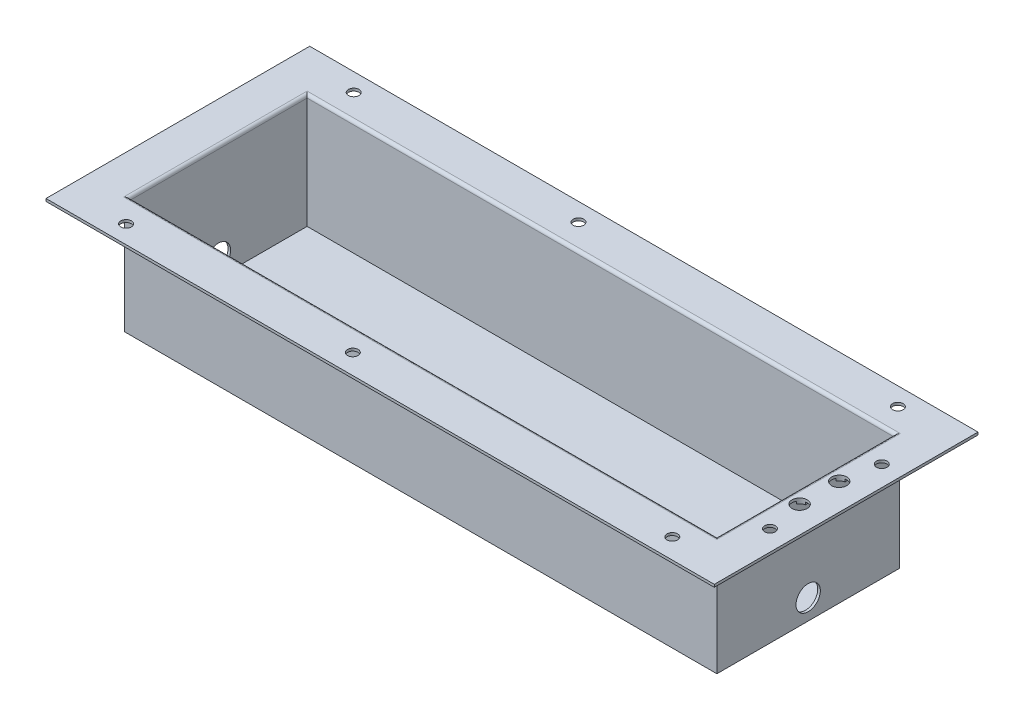
from build123d import *

# Parameters (mm, degrees)
SKETCH1_W                = 370.84
SKETCH1_H                = 114.3
BOSS_EXTRUDE1_DEPTH      = 1.6256
SKETCH2_W                = 367.5888
SKETCH2_H                = 111.0488
BOSS_EXTRUDE2_DEPTH      = 69.85
SKETCH3_W                = 418.3888
SKETCH3_H                = 165.1
SKETCH3_W_2              = 367.5888
SKETCH3_H_2              = 111.0488
BOSS_EXTRUDE3_DEPTH      = 1.6256
FILLET1_R                = 1.905
SKETCH6_W                = 376.4788
SKETCH6_H                = 119.9388
BOSS_EXTRUDE4_DEPTH      = 3.175
SKETCH8_R                = 7.62
CUT_EXTRUDE2_DEPTH       = 410.730170513
CUT_EXTRUDE10_DEPTH      = 237.475336838
CUT_EXTRUDE10_DEPTH_BACK = 237.475336838
SKETCH13_R               = 3.325
CUT_EXTRUDE11_DEPTH      = 237.475336838
CUT_EXTRUDE11_DEPTH_BACK = 237.475336838
SKETCH14_R               = 4.75


with BuildPart() as part:
    # Sketch1 → Boss-Extrude1 (new body)
    with BuildSketch(Plane(origin=(0, 0, 0), x_dir=(1, 0, 0), z_dir=(0, 1, 0))):
        Rectangle(SKETCH1_W, SKETCH1_H)
    extrude(amount=BOSS_EXTRUDE1_DEPTH)

    # Sketch2 → Boss-Extrude2 (add)
    with BuildSketch(Plane(origin=(0, 1.6256, 0), x_dir=(1, 0, 0), z_dir=(0, 1, 0))):
        Polygon((-183.7944, 57.15), (-185.42, 57.15), (-185.42, -57.15), (185.42, -57.15), (185.42, 57.15), align=None)
        Rectangle(SKETCH2_W, SKETCH2_H, mode=Mode.SUBTRACT)
    extrude(amount=BOSS_EXTRUDE2_DEPTH)

    # Sketch3 → Boss-Extrude3 (add)
    with BuildSketch(Plane(origin=(0, 71.4756, 0), x_dir=(1, 0, 0), z_dir=(0, 1, 0))):
        Rectangle(SKETCH3_W, SKETCH3_H)
        Rectangle(SKETCH3_W_2, SKETCH3_H_2, mode=Mode.SUBTRACT)
    extrude(amount=BOSS_EXTRUDE3_DEPTH)

    # Fillet1
    fillet1_edges = [part.edges().sort_by_distance(p)[0] for p in [
        (0, 71.4756, 57.15),
        (185.42, 71.4756, 0),
        (0, 71.4756, -57.15),
        (-185.42, 71.4756, 0),
        (-183.7944, 73.1012, 0),
        (0, 73.1012, -55.5244),
        (183.7944, 73.1012, 0),
        (0, 73.1012, 55.5244),
    ]]
    fillet(fillet1_edges, radius=FILLET1_R)

    # Sketch6 → Boss-Extrude4 (add)
    with BuildSketch(Plane(origin=(0, 73.1012, 0), x_dir=(1, 0, 0), z_dir=(0, 1, 0))):
        Polygon((188.2394, -63.1444), (-188.2394, -63.1444), (-191.4144, -63.1444), (-191.4144, 63.1444), (-188.2394, 63.1444), (188.2394, 63.1444), (191.4144, 63.1444), (191.4144, -63.1444), align=None)
        Rectangle(SKETCH6_W, SKETCH6_H, mode=Mode.SUBTRACT)
    extrude(amount=-BOSS_EXTRUDE4_DEPTH)

    # Sketch8 → Cut-Extrude2 (cut, through all)
    with BuildSketch(Plane(origin=(185.42, 0, 0), x_dir=(0, 0, -1), z_dir=(1, 0, 0))):
        with Locations((0, 12.7)):
            Circle(SKETCH8_R)
    extrude(amount=-CUT_EXTRUDE2_DEPTH, mode=Mode.SUBTRACT)

    # Sketch13 → Cut-Extrude10 (cut, two sides: drawn at the far end of the back side and taken through both)
    with BuildSketch(Plane(origin=(0, 73.1012, 0), x_dir=(1, 0, 0), z_dir=(0, 1, 0)).offset(-CUT_EXTRUDE10_DEPTH_BACK)):
        with Locations((-29.6556, -70)):
            Circle(SKETCH13_R)
        with Locations((170.3444, -70)):
            Circle(SKETCH13_R)
        with Locations((170.3444, 71.25665986)):
            Circle(SKETCH13_R)
        with Locations((-29.6556, 71.25665986)):
            Circle(SKETCH13_R)
        with Locations((196.4944, -35)):
            Circle(SKETCH13_R)
        with Locations((196.4944, 35)):
            Circle(SKETCH13_R)
        with Locations((-170.3444, 71.25665986)):
            Circle(SKETCH13_R)
        with Locations((-170.3444, -71.25665986)):
            Circle(SKETCH13_R)
    extrude(amount=CUT_EXTRUDE10_DEPTH + CUT_EXTRUDE10_DEPTH_BACK, mode=Mode.SUBTRACT)

    # Sketch14 → Cut-Extrude11 (cut, two sides: drawn at the far end of the back side and taken through both)
    with BuildSketch(Plane(origin=(0, 73.1012, 0), x_dir=(1, 0, 0), z_dir=(0, 1, 0)).offset(-CUT_EXTRUDE11_DEPTH_BACK)):
        with Locations((192.44588615, -12.38849737)):
            Circle(SKETCH14_R)
        with Locations((192.44588615, 12.38849737)):
            Circle(SKETCH14_R)
    extrude(amount=CUT_EXTRUDE11_DEPTH + CUT_EXTRUDE11_DEPTH_BACK, mode=Mode.SUBTRACT)


solid = part.part
